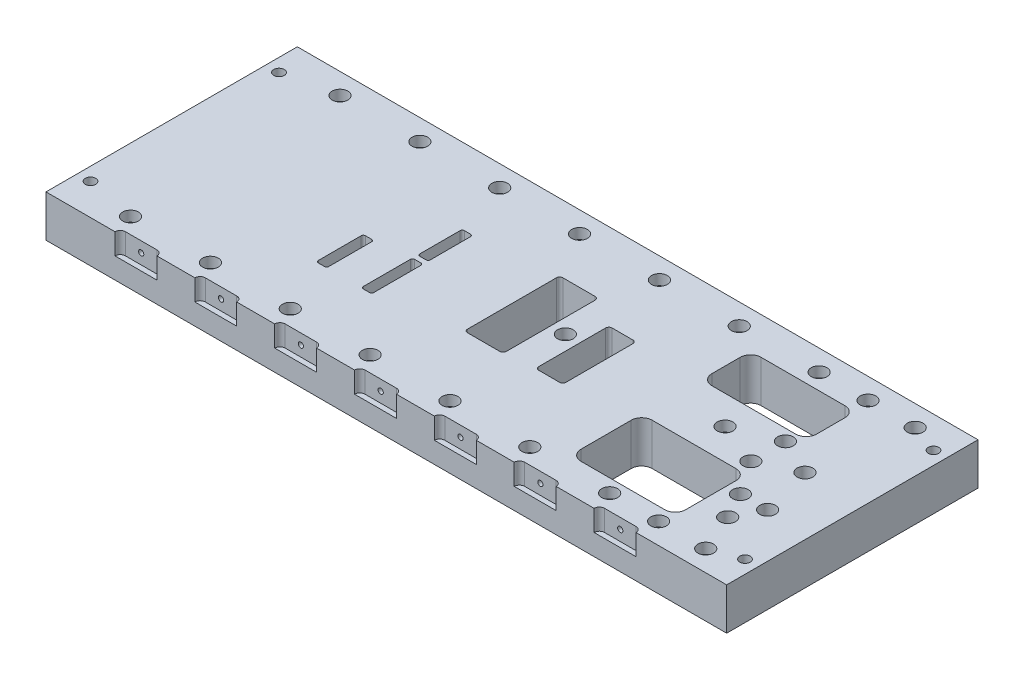
from build123d import *

# Parameters (mm, degrees)
SKETCH1_W                    = 650
SKETCH1_H                    = 240
BOSS_EXTRUDE1_DEPTH          = 40
CUT_EXTRUDE2_REACH           = 350.748
SKETCH3_R                    = 7.5
SKETCH4_R                    = 9
CUT_EXTRUDE3_DEPTH           = 5
SKETCH11_R                   = 7.5
CUT_EXTRUDE9_DEPTH           = 643.21019682
SKETCH12_R                   = 10
CUT_EXTRUDE10_DEPTH          = 5
SKETCH13_R                   = 10
CUT_EXTRUDE11_DEPTH          = 30
M10_TAPPED_HOLE1_D           = 8.5
M10_TAPPED_HOLE1_DEPTH       = 27.5
M10_TAPPED_HOLE1_CSINK_D     = 10.05
M10_TAPPED_HOLE1_CSINK_ANGLE = 90
M10_TAPPED_HOLE1_TIP         = 2.553657631
F_10_0MM_DOWEL_HOLE2_D       = 10
CUT_EXTRUDE12_REACH          = 350.748
SKETCH28_R                   = 7.5
SKETCH29_R                   = 9
CUT_EXTRUDE13_DEPTH          = 30
CUT_EXTRUDE14_DEPTH          = 20
LPATTERN1_COUNT              = 7
LPATTERN1_PITCH              = 76.25
CUT_EXTRUDE15_REACH          = 350.748
CUT_EXTRUDE16_REACH          = 350.748
CUT_EXTRUDE17_REACH          = 350.748


with BuildPart() as part:
    # Sketch1 → Boss-Extrude1 (new body)
    with BuildSketch(Plane(origin=(0, 0, 0), x_dir=(1, 0, 0), z_dir=(0, 1, 0))):
        Rectangle(SKETCH1_W, SKETCH1_H)
    extrude(amount=-BOSS_EXTRUDE1_DEPTH)

    # Sketch3 → Cut-Extrude2 (cut, up to next)
    with BuildSketch(Plane(origin=(0, 0, 0), x_dir=(1, 0, 0), z_dir=(0, 1, 0)), mode=Mode.PRIVATE) as cut_extrude2_sk1:
        with Locations((234.38, 26.73)):
            Circle(SKETCH3_R)
    cut_extrude2_tool1 = extrude(cut_extrude2_sk1.sketch, amount=-CUT_EXTRUDE2_REACH, mode=Mode.PRIVATE) & part.part
    # Sketch3 → Cut-Extrude2 (cut, up to next)
    with BuildSketch(Plane(origin=(0, 0, 0), x_dir=(1, 0, 0), z_dir=(0, 1, 0)), mode=Mode.PRIVATE) as cut_extrude2_sk2:
        with Locations((234.38, -6.27)):
            Circle(SKETCH3_R)
    cut_extrude2_tool2 = extrude(cut_extrude2_sk2.sketch, amount=-CUT_EXTRUDE2_REACH, mode=Mode.PRIVATE) & part.part
    # Sketch3 → Cut-Extrude2 (cut, up to next)
    with BuildSketch(Plane(origin=(0, 0, 0), x_dir=(1, 0, 0), z_dir=(0, 1, 0)), mode=Mode.PRIVATE) as cut_extrude2_sk3:
        with Locations((269.5, -63.53)):
            Circle(SKETCH3_R)
    cut_extrude2_tool3 = extrude(cut_extrude2_sk3.sketch, amount=-CUT_EXTRUDE2_REACH, mode=Mode.PRIVATE) & part.part
    # Sketch3 → Cut-Extrude2 (cut, up to next)
    with BuildSketch(Plane(origin=(0, 0, 0), x_dir=(1, 0, 0), z_dir=(0, 1, 0)), mode=Mode.PRIVATE) as cut_extrude2_sk4:
        with Locations((282.5, -38.4)):
            Circle(SKETCH3_R)
    cut_extrude2_tool4 = extrude(cut_extrude2_sk4.sketch, amount=-CUT_EXTRUDE2_REACH, mode=Mode.PRIVATE) & part.part
    # Sketch3 → Cut-Extrude2 (cut, up to next)
    with BuildSketch(Plane(origin=(0, 0, 0), x_dir=(1, 0, 0), z_dir=(0, 1, 0)), mode=Mode.PRIVATE) as cut_extrude2_sk5:
        with Locations((256.5, -38.4)):
            Circle(SKETCH3_R)
    cut_extrude2_tool5 = extrude(cut_extrude2_sk5.sketch, amount=-CUT_EXTRUDE2_REACH, mode=Mode.PRIVATE) & part.part
    # Sketch3 → Cut-Extrude2 (cut, up to next)
    with BuildSketch(Plane(origin=(0, 0, 0), x_dir=(1, 0, 0), z_dir=(0, 1, 0)), mode=Mode.PRIVATE) as cut_extrude2_sk6:
        with BuildLine():
            Line((153.25, 84.63), (233.25, 84.63))
            ThreePointArc((233.25, 84.63), (240.321067812, 81.701067812), (243.25, 74.63))
            Line((243.25, 74.63), (243.25, 47.63))
            ThreePointArc((243.25, 47.63), (240.321067812, 40.558932188), (233.25, 37.63))
            Line((233.25, 37.63), (153.25, 37.63))
            ThreePointArc((153.25, 37.63), (146.178932188, 40.558932188), (143.25, 47.63))
            Line((143.25, 47.63), (143.25, 74.63))
            ThreePointArc((143.25, 74.63), (146.178932188, 81.701067812), (153.25, 84.63))
        make_face()
    cut_extrude2_tool6 = extrude(cut_extrude2_sk6.sketch, amount=-CUT_EXTRUDE2_REACH, mode=Mode.PRIVATE) & part.part
    # Sketch3 → Cut-Extrude2 (cut, up to next)
    with BuildSketch(Plane(origin=(0, 0, 0), x_dir=(1, 0, 0), z_dir=(0, 1, 0)), mode=Mode.PRIVATE) as cut_extrude2_sk7:
        with BuildLine():
            Line((153.25, -19.4), (233.25, -19.4))
            ThreePointArc((233.25, -19.4), (240.321067812, -22.328932188), (243.25, -29.4))
            Line((243.25, -29.4), (243.25, -77.4))
            ThreePointArc((243.25, -77.4), (240.321067812, -84.471067812), (233.25, -87.4))
            Line((233.25, -87.4), (153.25, -87.4))
            ThreePointArc((153.25, -87.4), (146.178932188, -84.471067812), (143.25, -77.4))
            Line((143.25, -77.4), (143.25, -29.4))
            ThreePointArc((143.25, -29.4), (146.178932188, -22.328932188), (153.25, -19.4))
        make_face()
    cut_extrude2_tool7 = extrude(cut_extrude2_sk7.sketch, amount=-CUT_EXTRUDE2_REACH, mode=Mode.PRIVATE) & part.part
    add(cut_extrude2_tool1.solids().sort_by_distance((234.38, 0, -26.73))[0], mode=Mode.SUBTRACT)
    add(cut_extrude2_tool2.solids().sort_by_distance((234.38, 0, 6.27))[0], mode=Mode.SUBTRACT)
    add(cut_extrude2_tool3.solids().sort_by_distance((269.5, 0, 63.53))[0], mode=Mode.SUBTRACT)
    add(cut_extrude2_tool4.solids().sort_by_distance((282.5, 0, 38.4))[0], mode=Mode.SUBTRACT)
    add(cut_extrude2_tool5.solids().sort_by_distance((256.5, 0, 38.4))[0], mode=Mode.SUBTRACT)
    add(cut_extrude2_tool6.solids().sort_by_distance((193.25, 0, -61.13))[0], mode=Mode.SUBTRACT)
    add(cut_extrude2_tool7.solids().sort_by_distance((193.25, 0, 53.4))[0], mode=Mode.SUBTRACT)

    # Sketch4 → Cut-Extrude3 (cut)
    with BuildSketch(Plane.XZ.offset(40)):
        with Locations((234.38, -26.73)):
            Circle(SKETCH4_R)
        with Locations((234.38, 6.27)):
            Circle(SKETCH4_R)
        with Locations((256.5, 38.4)):
            Circle(SKETCH4_R)
        with Locations((282.5, 38.4)):
            Circle(SKETCH4_R)
        with Locations((269.5, 63.53)):
            Circle(SKETCH4_R)
    extrude(amount=-CUT_EXTRUDE3_DEPTH, mode=Mode.SUBTRACT)

    # Sketch11 → Cut-Extrude9 (cut, through all)
    with BuildSketch(Plane(origin=(304.63, 0, 0), x_dir=(1, 0, 0), z_dir=(0, 1, 0))):
        with Locations((-35.13, 10.23)):
            Circle(SKETCH11_R)
        with Locations((-111.38, 10.23)):
            Circle(SKETCH11_R)
        with Locations((-263.88, 10.23)):
            Circle(SKETCH11_R)
    extrude(amount=-CUT_EXTRUDE9_DEPTH, mode=Mode.SUBTRACT)

    # Sketch12 → Cut-Extrude10 (cut)
    with BuildSketch(Plane(origin=(304.63, -40, 0), x_dir=(1, 0, 0), z_dir=(0, -1, 0))):
        with Locations((-35.13, -10.23)):
            Circle(SKETCH12_R)
    extrude(amount=-CUT_EXTRUDE10_DEPTH, mode=Mode.SUBTRACT)

    # Sketch13 → Cut-Extrude11 (cut)
    with BuildSketch(Plane(origin=(304.63, -40, 0), x_dir=(1, 0, 0), z_dir=(0, -1, 0))):
        with Locations((-111.38, -10.23)):
            Circle(SKETCH13_R)
        with Locations((-263.88, -10.23)):
            Circle(SKETCH13_R)
    extrude(amount=-CUT_EXTRUDE11_DEPTH, mode=Mode.SUBTRACT)

    # M10 Tapped Hole1
    with Locations(Plane(origin=(0, -40, 0), x_dir=(-1, 0, 0), z_dir=(0, -1, 0))):
        with Locations((-312.5, 107.5), (312.5, 107.5), (312.5, -107.5), (-312.5, -107.5)):
            CounterSinkHole(M10_TAPPED_HOLE1_D / 2, M10_TAPPED_HOLE1_CSINK_D / 2, depth=M10_TAPPED_HOLE1_DEPTH, counter_sink_angle=M10_TAPPED_HOLE1_CSINK_ANGLE)
            with Locations((0, 0, -(M10_TAPPED_HOLE1_DEPTH + M10_TAPPED_HOLE1_TIP / 2))):  # 118° drill point
                Cone(0, M10_TAPPED_HOLE1_D / 2, M10_TAPPED_HOLE1_TIP, mode=Mode.SUBTRACT)

    # Ø10.0mm Dowel Hole2 (through all)
    with Locations(Plane(origin=(0, -40, 0), x_dir=(-1, 0, 0), z_dir=(0, -1, 0))):
        with Locations((-312.5, 90), (312.5, 90), (312.5, -90), (-312.5, -90)):
            Hole(F_10_0MM_DOWEL_HOLE2_D / 2)

    # Sketch28 → Cut-Extrude12 (cut, up to next)
    with BuildSketch(Plane(origin=(0, 0, 0), x_dir=(1, 0, 0), z_dir=(0, 1, 0)), mode=Mode.PRIVATE) as cut_extrude12_sk1:
        with Locations((240, -100)):
            Circle(SKETCH28_R)
    cut_extrude12_tool1 = extrude(cut_extrude12_sk1.sketch, amount=-CUT_EXTRUDE12_REACH, mode=Mode.PRIVATE) & part.part
    # Sketch28 → Cut-Extrude12 (cut, up to next)
    with BuildSketch(Plane(origin=(0, 0, 0), x_dir=(1, 0, 0), z_dir=(0, 1, 0)), mode=Mode.PRIVATE) as cut_extrude12_sk2:
        with Locations((285, -100)):
            Circle(SKETCH28_R)
    cut_extrude12_tool2 = extrude(cut_extrude12_sk2.sketch, amount=-CUT_EXTRUDE12_REACH, mode=Mode.PRIVATE) & part.part
    # Sketch28 → Cut-Extrude12 (cut, up to next)
    with BuildSketch(Plane(origin=(0, 0, 0), x_dir=(1, 0, 0), z_dir=(0, 1, 0)), mode=Mode.PRIVATE) as cut_extrude12_sk3:
        with Locations((117, -100)):
            Circle(SKETCH28_R)
    cut_extrude12_tool3 = extrude(cut_extrude12_sk3.sketch, amount=-CUT_EXTRUDE12_REACH, mode=Mode.PRIVATE) & part.part
    # Sketch28 → Cut-Extrude12 (cut, up to next)
    with BuildSketch(Plane(origin=(0, 0, 0), x_dir=(1, 0, 0), z_dir=(0, 1, 0)), mode=Mode.PRIVATE) as cut_extrude12_sk4:
        with Locations((40.75, -100)):
            Circle(SKETCH28_R)
    cut_extrude12_tool4 = extrude(cut_extrude12_sk4.sketch, amount=-CUT_EXTRUDE12_REACH, mode=Mode.PRIVATE) & part.part
    # Sketch28 → Cut-Extrude12 (cut, up to next)
    with BuildSketch(Plane(origin=(0, 0, 0), x_dir=(1, 0, 0), z_dir=(0, 1, 0)), mode=Mode.PRIVATE) as cut_extrude12_sk5:
        with Locations((193.25, -100)):
            Circle(SKETCH28_R)
    cut_extrude12_tool5 = extrude(cut_extrude12_sk5.sketch, amount=-CUT_EXTRUDE12_REACH, mode=Mode.PRIVATE) & part.part
    # Sketch28 → Cut-Extrude12 (cut, up to next)
    with BuildSketch(Plane(origin=(0, 0, 0), x_dir=(1, 0, 0), z_dir=(0, 1, 0)), mode=Mode.PRIVATE) as cut_extrude12_sk6:
        with Locations((-35.5, -100)):
            Circle(SKETCH28_R)
    cut_extrude12_tool6 = extrude(cut_extrude12_sk6.sketch, amount=-CUT_EXTRUDE12_REACH, mode=Mode.PRIVATE) & part.part
    # Sketch28 → Cut-Extrude12 (cut, up to next)
    with BuildSketch(Plane(origin=(0, 0, 0), x_dir=(1, 0, 0), z_dir=(0, 1, 0)), mode=Mode.PRIVATE) as cut_extrude12_sk7:
        with Locations((-111.75, -100)):
            Circle(SKETCH28_R)
    cut_extrude12_tool7 = extrude(cut_extrude12_sk7.sketch, amount=-CUT_EXTRUDE12_REACH, mode=Mode.PRIVATE) & part.part
    # Sketch28 → Cut-Extrude12 (cut, up to next)
    with BuildSketch(Plane(origin=(0, 0, 0), x_dir=(1, 0, 0), z_dir=(0, 1, 0)), mode=Mode.PRIVATE) as cut_extrude12_sk8:
        with Locations((-188, -100)):
            Circle(SKETCH28_R)
    cut_extrude12_tool8 = extrude(cut_extrude12_sk8.sketch, amount=-CUT_EXTRUDE12_REACH, mode=Mode.PRIVATE) & part.part
    # Sketch28 → Cut-Extrude12 (cut, up to next)
    with BuildSketch(Plane(origin=(0, 0, 0), x_dir=(1, 0, 0), z_dir=(0, 1, 0)), mode=Mode.PRIVATE) as cut_extrude12_sk9:
        with Locations((-264.25, -100)):
            Circle(SKETCH28_R)
    cut_extrude12_tool9 = extrude(cut_extrude12_sk9.sketch, amount=-CUT_EXTRUDE12_REACH, mode=Mode.PRIVATE) & part.part
    cut_extrude12_1 = cut_extrude12_tool1.solids().sort_by_distance((240, 0, 100))[0]
    add(cut_extrude12_1, mode=Mode.SUBTRACT)
    cut_extrude12_2 = cut_extrude12_tool2.solids().sort_by_distance((285, 0, 100))[0]
    add(cut_extrude12_2, mode=Mode.SUBTRACT)
    cut_extrude12_3 = cut_extrude12_tool3.solids().sort_by_distance((117, 0, 100))[0]
    add(cut_extrude12_3, mode=Mode.SUBTRACT)
    cut_extrude12_4 = cut_extrude12_tool4.solids().sort_by_distance((40.75, 0, 100))[0]
    add(cut_extrude12_4, mode=Mode.SUBTRACT)
    cut_extrude12_5 = cut_extrude12_tool5.solids().sort_by_distance((193.25, 0, 100))[0]
    add(cut_extrude12_5, mode=Mode.SUBTRACT)
    cut_extrude12_6 = cut_extrude12_tool6.solids().sort_by_distance((-35.5, 0, 100))[0]
    add(cut_extrude12_6, mode=Mode.SUBTRACT)
    cut_extrude12_7 = cut_extrude12_tool7.solids().sort_by_distance((-111.75, 0, 100))[0]
    add(cut_extrude12_7, mode=Mode.SUBTRACT)
    cut_extrude12_8 = cut_extrude12_tool8.solids().sort_by_distance((-188, 0, 100))[0]
    add(cut_extrude12_8, mode=Mode.SUBTRACT)
    cut_extrude12_9 = cut_extrude12_tool9.solids().sort_by_distance((-264.25, 0, 100))[0]
    add(cut_extrude12_9, mode=Mode.SUBTRACT)
    cut_extrude12 = cut_extrude12_1 + cut_extrude12_2 + cut_extrude12_3 + cut_extrude12_4 + cut_extrude12_5 + cut_extrude12_6 + cut_extrude12_7 + cut_extrude12_8 + cut_extrude12_9  # Cut-Extrude12 as one shape, for the pattern or mirror that repeats it

    # Mirror1: Cut-Extrude12 across plane
    add(cut_extrude12.mirror(Plane.XY), mode=Mode.SUBTRACT)

    # Sketch29 → Cut-Extrude13 (cut)
    with BuildSketch(Plane.XZ.offset(40)):
        with Locations((193.25, 100)):
            Circle(SKETCH29_R)
        with Locations((240, 100)):
            Circle(SKETCH29_R)
        with Locations((240, -100)):
            Circle(SKETCH29_R)
        with Locations((193.25, -100)):
            Circle(SKETCH29_R)
        with Locations((285, 100)):
            Circle(SKETCH29_R)
        with Locations((285, -100)):
            Circle(SKETCH29_R)
        with Locations((117, 100)):
            Circle(SKETCH29_R)
        with Locations((117, -100)):
            Circle(SKETCH29_R)
        with Locations((40.75, 100)):
            Circle(SKETCH29_R)
        with Locations((40.75, -100)):
            Circle(SKETCH29_R)
        with Locations((-35.5, 100)):
            Circle(SKETCH29_R)
        with Locations((-35.5, -100)):
            Circle(SKETCH29_R)
        with Locations((-111.75, 100)):
            Circle(SKETCH29_R)
        with Locations((-111.75, -100)):
            Circle(SKETCH29_R)
        with Locations((-188, 100)):
            Circle(SKETCH29_R)
        with Locations((-188, -100)):
            Circle(SKETCH29_R)
        with Locations((-264.25, 100)):
            Circle(SKETCH29_R)
        with Locations((-264.25, -100)):
            Circle(SKETCH29_R)
    extrude(amount=-CUT_EXTRUDE13_DEPTH, mode=Mode.SUBTRACT)

    # Sketch30 → Cut-Extrude14 (cut)
    with BuildSketch(Plane(origin=(304.63, 0, 0), x_dir=(1, 0, 0), z_dir=(0, 1, 0))):
        with BuildLine():
            Line((-106.25, -120), (-66.25, -120))
            ThreePointArc((-66.25, -120), (-67.714466094, -116.464466094), (-71.25, -115))
            Line((-71.25, -115), (-101.25, -115))
            ThreePointArc((-101.25, -115), (-104.785533906, -116.464466094), (-106.25, -120))
        make_face()
    cut_extrude14 = extrude(amount=-CUT_EXTRUDE14_DEPTH, mode=Mode.SUBTRACT)

    # Sketch32 → M6 Tapped Hole1 (revolve, cut)
    with BuildSketch(Plane(origin=(218.38, -10, 115), x_dir=(0, -1, 0), z_dir=(1, 0, 0))):
        Polygon((0, 0), (0, 11.502151548), (2.5, 10), (2.5, 0), align=None)
    m6_tapped_hole1 = revolve(axis=Axis((218.38, -10, 121.35), (0, 0, -1)), mode=Mode.SUBTRACT)

    # LPattern1: Cut-Extrude14, M6 Tapped Hole1 ×7
    with Locations(*[(-i * LPATTERN1_PITCH, 0, 0) for i in range(1, LPATTERN1_COUNT)]):
        add(cut_extrude14, mode=Mode.SUBTRACT)
        add(m6_tapped_hole1, mode=Mode.SUBTRACT)

    # Sketch38 → Cut-Extrude15 (cut, up to next)
    with BuildSketch(Plane(origin=(0, 0, 0), x_dir=(1, 0, 0), z_dir=(0, 1, 0)), mode=Mode.PRIVATE) as cut_extrude15_sk1:
        with BuildLine():
            Line((57.75, -32.27), (77.75, -32.27))
            ThreePointArc((77.75, -32.27), (79.871320344, -31.391320344), (80.75, -29.27))
            Line((80.75, -29.27), (80.75, 34.73))
            ThreePointArc((80.75, 34.73), (79.871320344, 36.851320344), (77.75, 37.73))
            Line((77.75, 37.73), (57.75, 37.73))
            ThreePointArc((57.75, 37.73), (55.628679656, 36.851320344), (54.75, 34.73))
            Line((54.75, 34.73), (54.75, -29.27))
            ThreePointArc((54.75, -29.27), (55.628679656, -31.391320344), (57.75, -32.27))
        make_face()
    cut_extrude15_tool1 = extrude(cut_extrude15_sk1.sketch, amount=-CUT_EXTRUDE15_REACH, mode=Mode.PRIVATE) & part.part
    add(cut_extrude15_tool1.solids().sort_by_distance((67.75, 0, -2.73))[0], mode=Mode.SUBTRACT)

    # Sketch39 → Cut-Extrude16 (cut, up to next)
    with BuildSketch(Plane(origin=(0, 0, 0), x_dir=(1, 0, 0), z_dir=(0, 1, 0)), mode=Mode.PRIVATE) as cut_extrude16_sk1:
        with BuildLine():
            Line((-7.25, -35.27), (23.75, -35.27))
            ThreePointArc((23.75, -35.27), (25.871320344, -34.391320344), (26.75, -32.27))
            Line((26.75, -32.27), (26.75, 52.73))
            ThreePointArc((26.75, 52.73), (25.871320344, 54.851320344), (23.75, 55.73))
            Line((23.75, 55.73), (-7.25, 55.73))
            ThreePointArc((-7.25, 55.73), (-9.371320344, 54.851320344), (-10.25, 52.73))
            Line((-10.25, 52.73), (-10.25, -32.27))
            ThreePointArc((-10.25, -32.27), (-9.371320344, -34.391320344), (-7.25, -35.27))
        make_face()
    cut_extrude16_tool1 = extrude(cut_extrude16_sk1.sketch, amount=-CUT_EXTRUDE16_REACH, mode=Mode.PRIVATE) & part.part
    add(cut_extrude16_tool1.solids().sort_by_distance((8.25, 0, -10.23))[0], mode=Mode.SUBTRACT)

    # Sketch40 → Cut-Extrude17 (cut, up to next)
    with BuildSketch(Plane(origin=(0, 0, 0), x_dir=(1, 0, 0), z_dir=(0, 1, 0)), mode=Mode.PRIVATE) as cut_extrude17_sk1:
        with BuildLine():
            Line((-93.25, -48.77), (-87.25, -48.77))
            ThreePointArc((-87.25, -48.77), (-85.835786438, -48.184213562), (-85.25, -46.77))
            Line((-85.25, -46.77), (-85.25, -1.77))
            ThreePointArc((-85.25, -1.77), (-85.835786438, -0.355786438), (-87.25, 0.23))
            Line((-87.25, 0.23), (-93.25, 0.23))
            ThreePointArc((-93.25, 0.23), (-94.664213562, -0.355786438), (-95.25, -1.77))
            Line((-95.25, -1.77), (-95.25, -46.77))
            ThreePointArc((-95.25, -46.77), (-94.664213562, -48.184213562), (-93.25, -48.77))
        make_face()
    cut_extrude17_tool1 = extrude(cut_extrude17_sk1.sketch, amount=-CUT_EXTRUDE17_REACH, mode=Mode.PRIVATE) & part.part
    # Sketch40 → Cut-Extrude17 (cut, up to next)
    with BuildSketch(Plane(origin=(0, 0, 0), x_dir=(1, 0, 0), z_dir=(0, 1, 0)), mode=Mode.PRIVATE) as cut_extrude17_sk2:
        with BuildLine():
            Line((-136.25, -48.77), (-130.25, -48.77))
            ThreePointArc((-130.25, -48.77), (-128.835786438, -48.184213562), (-128.25, -46.77))
            Line((-128.25, -46.77), (-128.25, -5.77))
            ThreePointArc((-128.25, -5.77), (-128.835786438, -4.355786438), (-130.25, -3.77))
            Line((-130.25, -3.77), (-136.25, -3.77))
            ThreePointArc((-136.25, -3.77), (-137.664213562, -4.355786438), (-138.25, -5.77))
            Line((-138.25, -5.77), (-138.25, -46.77))
            ThreePointArc((-138.25, -46.77), (-137.664213562, -48.184213562), (-136.25, -48.77))
        make_face()
    cut_extrude17_tool2 = extrude(cut_extrude17_sk2.sketch, amount=-CUT_EXTRUDE17_REACH, mode=Mode.PRIVATE) & part.part
    # Sketch40 → Cut-Extrude17 (cut, up to next)
    with BuildSketch(Plane(origin=(0, 0, 0), x_dir=(1, 0, 0), z_dir=(0, 1, 0)), mode=Mode.PRIVATE) as cut_extrude17_sk3:
        with BuildLine():
            Line((-93.25, 5.23), (-87.25, 5.23))
            ThreePointArc((-87.25, 5.23), (-85.835786438, 5.815786438), (-85.25, 7.23))
            Line((-85.25, 7.23), (-85.25, 45.73))
            ThreePointArc((-85.25, 45.73), (-85.835786438, 47.144213562), (-87.25, 47.73))
            Line((-87.25, 47.73), (-93.25, 47.73))
            ThreePointArc((-93.25, 47.73), (-94.664213562, 47.144213562), (-95.25, 45.73))
            Line((-95.25, 45.73), (-95.25, 7.23))
            ThreePointArc((-95.25, 7.23), (-94.664213562, 5.815786438), (-93.25, 5.23))
        make_face()
    cut_extrude17_tool3 = extrude(cut_extrude17_sk3.sketch, amount=-CUT_EXTRUDE17_REACH, mode=Mode.PRIVATE) & part.part
    add(cut_extrude17_tool1.solids().sort_by_distance((-90.25, 0, 24.27))[0], mode=Mode.SUBTRACT)
    add(cut_extrude17_tool2.solids().sort_by_distance((-133.25, 0, 26.27))[0], mode=Mode.SUBTRACT)
    add(cut_extrude17_tool3.solids().sort_by_distance((-90.25, 0, -26.48))[0], mode=Mode.SUBTRACT)


solid = part.part
